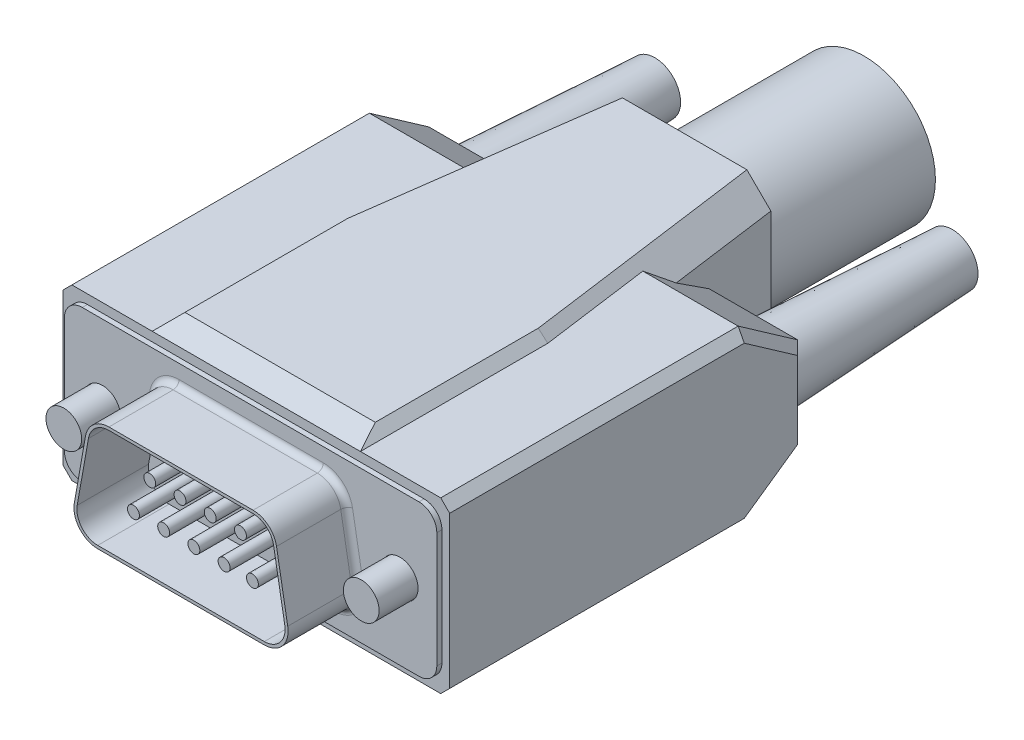
from build123d import *
from OCP.BRepFilletAPI import BRepFilletAPI_MakeChamfer

# Parameters (mm, degrees)
SKETCH1_W                        = 31.3
SKETCH1_H                        = 12.7
SKETCH1_R                        = 1.525
BASE_EXTRUDE_DEPTH               = 0.215
FILLET6_R                        = 1.5
BOSS_EXTRUDE2_DEPTH              = 5.9
FILLET8_R                        = 0.5
CUT_EXTRUDE1_DEPTH               = 6
SKETCH8_R                        = 0.5
BOSS_EXTRUDE3_DEPTH              = 5
LPATTERN1_COUNT                  = 4
LPATTERN1_PITCH                  = 2.54
SKETCH9_W                        = 32.5
SKETCH9_H                        = 14.25
BOSS_EXTRUDE4_DEPTH              = 30
SKETCH11_R                       = 2
CUT_EXTRUDE3_DEPTH               = 20
BOSS_EXTRUDE6_DEPTH              = 6
BOSS_EXTRUDE6_DEPTH_BACK         = 30
SKETCH12_W                       = 17.5
SKETCH12_H                       = 15.75
CHAMFER1_SIZE                    = 5
CHAMFER1_SIZE2                   = 3.5
CHAMFER3_SIZE                    = 11
CHAMFER3_SIZE_2                  = 1.5
CHAMFER4_SIZE                    = 2
CHAMFER6_SIZE                    = 0.75
CHAMFER7_SIZE                    = 0.75
CHAMFER7_SIZE2                   = 2
SKETCH18_R                       = 6
BOSS_EXTRUDE8_DEPTH              = 15.080000066
SKETCH20_R                       = 0.5
BOSS_EXTRUDE10_DEPTH             = 5
SKETCH22_R                       = 2
BOSS_EXTRUDE12_DEPTH             = 2
BOSS_EXTRUDE12_DIRECTION_2_REACH = 42.57
SKETCH21_R                       = 1.5
BOSS_EXTRUDE14_DEPTH             = 3.25
BOSS_EXTRUDE14_DIRECTION_2_REACH = 56.583
SKETCH23_R                       = 3
BOSS_EXTRUDE15_DEPTH             = 16
BOSS_EXTRUDE15_DRAFT             = 3
BOSS_EXTRUDE15_PROFILE_2_DEPTH   = 16
BOSS_EXTRUDE15_PROFILE_2_DRAFT   = 3


# Some blends are built 0.0001 mm under size
with BuildPart() as part:
    # Sketch1 → Base-Extrude (new, symmetric)
    with BuildSketch(Plane.XY):
        with Locations((-0.05, 0)):
            Rectangle(SKETCH1_W, SKETCH1_H)
        with Locations((12.5, 0)):
            Circle(SKETCH1_R, mode=Mode.SUBTRACT)
        with Locations(Location((-12.5, 0, 0), (0, 0, 180))):
            Circle(SKETCH1_R, mode=Mode.SUBTRACT)
    extrude(amount=BASE_EXTRUDE_DEPTH, both=True)

    # Fillet6
    fillet6_edges = [part.edges().sort_by_distance(p)[0] for p in [
        (-15.7, -6.35, 0),
        (15.6, -6.35, 0),
        (15.6, 6.35, 0),
        (-15.7, 6.35, 0),
    ]]
    fillet(fillet6_edges, radius=FILLET6_R)

    # Sketch4 → Boss-Extrude2 (add)
    with BuildSketch(Plane.XY.offset(0.215)):
        with BuildLine():
            Line((7, -4.67), (-7, -4.67))
            ThreePointArc((-7, -4.67), (-8.532088886, -3.955575219), (-8.969615506, -2.322703645))
            Line((-8.969615506, -2.322703645), (-8.028029429, 3.017296355))
            ThreePointArc((-8.028029429, 3.017296355), (-7.343989142, 4.202088886), (-6.058413923, 4.67))
            Line((-6.058413923, 4.67), (6.058413923, 4.67))
            ThreePointArc((6.058413923, 4.67), (7.343989142, 4.202088886), (8.028029429, 3.017296355))
            Line((8.028029429, 3.017296355), (8.969615506, -2.322703645))
            ThreePointArc((8.969615506, -2.322703645), (8.532088886, -3.955575219), (7, -4.67))
        make_face()
    extrude(amount=BOSS_EXTRUDE2_DEPTH)

    # Fillet8
    fillet8_edges = [part.edges().sort_by_distance(p)[0] for p in [
        (-8.532088886, -3.955575219, 0.215),
        (8.498822468, 0.347296355, 0.215),
        (-7.343989142, 4.202088886, 0.215),
        (-8.498822468, 0.347296355, 0.215),
        (0, 4.67, 0.215),
        (7.343989142, 4.202088886, 0.215),
        (8.532088886, -3.955575219, 0.215),
        (0, -4.67, 0.215),
    ]]
    fillet(fillet8_edges, radius=FILLET8_R)

    # Sketch5 → Cut-Extrude1 (cut)
    with BuildSketch(Plane.XY.offset(6.115)):
        with BuildLine():
            Line((-7, -4.42), (7, -4.42))
            ThreePointArc((7, -4.42), (8.340577775, -3.794878317), (8.723413568, -2.366115689))
            Line((8.723413568, -2.366115689), (7.781827491, 2.973884311))
            ThreePointArc((7.781827491, 2.973884311), (7.18329224, 4.010577775), (6.058413923, 4.42))
            Line((6.058413923, 4.42), (-6.058413923, 4.42))
            ThreePointArc((-6.058413923, 4.42), (-7.18329224, 4.010577775), (-7.781827491, 2.973884311))
            Line((-7.781827491, 2.973884311), (-8.723413568, -2.366115689))
            ThreePointArc((-8.723413568, -2.366115689), (-8.340577775, -3.794878317), (-7, -4.42))
        make_face()
    extrude(amount=-CUT_EXTRUDE1_DEPTH, mode=Mode.SUBTRACT)

    # Sketch8 → Boss-Extrude3 (add)
    with BuildSketch(Plane.XY.offset(0.115)):
        with Locations((-5, -1.5)):
            Circle(SKETCH8_R)
        with Locations((-3.625, 1.5)):
            Circle(SKETCH8_R)
    boss_extrude3 = extrude(amount=BOSS_EXTRUDE3_DEPTH)

    # LPattern1: Boss-Extrude3 ×4
    with Locations(*[(i * LPATTERN1_PITCH, 0, 0) for i in range(1, LPATTERN1_COUNT)]):
        add(boss_extrude3)

    # Sketch9 → Boss-Extrude4 (add)
    with BuildSketch(Plane(origin=(0, 0, -0.215), x_dir=(-1, 0, 0), z_dir=(0, 0, -1))):
        Rectangle(SKETCH9_W, SKETCH9_H)
    extrude(amount=BOSS_EXTRUDE4_DEPTH)

    # Sketch11 → Cut-Extrude3 (cut)
    with BuildSketch(Plane(origin=(0, 0, -30.215), x_dir=(-1, 0, 0), z_dir=(0, 0, -1))):
        with Locations((-12.5, 0)):
            Circle(SKETCH11_R)
        with Locations((12.5, 0)):
            Circle(SKETCH11_R)
    extrude(amount=-CUT_EXTRUDE3_DEPTH, mode=Mode.SUBTRACT)

    # Sketch12 → Boss-Extrude6 (add, two sides: drawn at the far end of the back side and taken through both)
    with BuildSketch(Plane(origin=(0, 0, -30.215), x_dir=(-1, 0, 0), z_dir=(0, 0, -1)).offset(-BOSS_EXTRUDE6_DEPTH_BACK)):
        Rectangle(SKETCH12_W, SKETCH12_H)
    extrude(amount=BOSS_EXTRUDE6_DEPTH + BOSS_EXTRUDE6_DEPTH_BACK)

    # Chamfer1: one chamfer whose edges measure the first distance from different faces: ONE call of the kernel's chamfer builder (chamfer() names one face for all edges)
    chamfer1_edges_1 = [part.edges().sort_by_distance(p)[0] for p in [
        (12.5, -7.125, -30.215),
    ]]
    chamfer1_side_1 = [part.faces().sort_by_distance(p)[0] for p in [
        (12.5, -7.125, -15.215),
    ]]
    chamfer1_edges_2 = [part.edges().sort_by_distance(p)[0] for p in [
        (-12.5, 7.125, -30.215),
    ]]
    chamfer1_side_2 = [part.faces().sort_by_distance(p)[0] for p in [
        (-12.5, 7.125, -15.215),
    ]]
    chamfer1_edges_3 = [part.edges().sort_by_distance(p)[0] for p in [
        (-12.5, -7.125, -30.215),
    ]]
    chamfer1_side_3 = [part.faces().sort_by_distance(p)[0] for p in [
        (-12.5, -7.125, -15.215),
    ]]
    chamfer1_edges_4 = [part.edges().sort_by_distance(p)[0] for p in [
        (12.5, 7.125, -30.215),
    ]]
    chamfer1_side_4 = [part.faces().sort_by_distance(p)[0] for p in [
        (12.5, 7.125, -15.215),
    ]]
    chamfer1 = BRepFilletAPI_MakeChamfer(part.part.solid().wrapped)
    for e in chamfer1_edges_1:
        chamfer1.Add(CHAMFER1_SIZE, CHAMFER1_SIZE2, e.wrapped, chamfer1_side_1[0].wrapped)  # the first distance lies on this face
    for e in chamfer1_edges_2:
        chamfer1.Add(CHAMFER1_SIZE, CHAMFER1_SIZE2, e.wrapped, chamfer1_side_2[0].wrapped)  # the first distance lies on this face
    for e in chamfer1_edges_3:
        chamfer1.Add(CHAMFER1_SIZE, CHAMFER1_SIZE2, e.wrapped, chamfer1_side_3[0].wrapped)  # the first distance lies on this face
    for e in chamfer1_edges_4:
        chamfer1.Add(CHAMFER1_SIZE, CHAMFER1_SIZE2, e.wrapped, chamfer1_side_4[0].wrapped)  # the first distance lies on this face
    add(Compound.cast(chamfer1.Shape()), mode=Mode.REPLACE)

    # Chamfer3
    # the kernel refuses this chamfer: 11, 1.5 mm, written as the material it takes off along each edge
    with BuildSketch(Plane(origin=(8.75, -36.465299494, -36.215), x_dir=(0, 0, 1), z_dir=(0, 1, 0))) as chamfer3_piece_1_section:
        Polygon((CHAMFER3_SIZE, 0), (0, -CHAMFER3_SIZE_2), (0, 0), align=None)
    chamfer3_piece_1 = extrude(amount=72.930598988, mode=Mode.PRIVATE)
    chamfer3_piece_1 = split(chamfer3_piece_1, bisect_by=Plane(origin=(8.75, -11.606038089, -18.813517016), z_dir=(0, -0.8192319205190406, -0.5734623443633283)), keep=Keep.TOP, mode=Mode.PRIVATE)
    add(chamfer3_piece_1, mode=Mode.SUBTRACT)
    with BuildSketch(Plane(origin=(8.75, -36.465299494, -36.215), x_dir=(0, 0, 1), z_dir=(0, 1, 0))) as chamfer3_piece_2_section:
        Polygon((CHAMFER3_SIZE, 0), (0, -CHAMFER3_SIZE_2), (0, 0), align=None)
    chamfer3_piece_2 = extrude(amount=72.930598988, mode=Mode.PRIVATE)
    chamfer3_piece_2 = split(chamfer3_piece_2, bisect_by=Plane(origin=(8.75, -36.465299494, -30.215), z_dir=(0, 0, -1)), keep=Keep.TOP, mode=Mode.PRIVATE)
    add(chamfer3_piece_2, mode=Mode.SUBTRACT)
    with BuildSketch(Plane(origin=(8.75, -36.465299494, -36.215), x_dir=(0, 0, 1), z_dir=(0, 1, 0))) as chamfer3_piece_3_section:
        Polygon((CHAMFER3_SIZE, 0), (0, -CHAMFER3_SIZE_2), (0, 0), align=None)
    chamfer3_piece_3 = extrude(amount=72.930598988, mode=Mode.PRIVATE)
    chamfer3_piece_3 = split(chamfer3_piece_3, bisect_by=Plane(origin=(8.75, -12.377850169, -53.076214527), z_dir=(0, 0.8192319205190406, -0.5734623443633283)), keep=Keep.TOP, mode=Mode.PRIVATE)
    add(chamfer3_piece_3, mode=Mode.SUBTRACT)
    with BuildSketch(Plane(origin=(-8.75, 36.465299494, -36.215), x_dir=(1, 0, 0), z_dir=(0, -1, 0))) as chamfer3_piece_4_section:
        Polygon((CHAMFER3_SIZE_2, 0), (0, CHAMFER3_SIZE), (0, 0), align=None)
    chamfer3_piece_4 = extrude(amount=72.930598988, mode=Mode.PRIVATE)
    chamfer3_piece_4 = split(chamfer3_piece_4, bisect_by=Plane(origin=(-8.75, 36.465299494, -30.215), z_dir=(0, 0, -1)), keep=Keep.TOP, mode=Mode.PRIVATE)
    add(chamfer3_piece_4, mode=Mode.SUBTRACT)
    with BuildSketch(Plane(origin=(-8.75, 36.465299494, -36.215), x_dir=(1, 0, 0), z_dir=(0, -1, 0))) as chamfer3_piece_5_section:
        Polygon((CHAMFER3_SIZE_2, 0), (0, CHAMFER3_SIZE), (0, 0), align=None)
    chamfer3_piece_5 = extrude(amount=72.930598988, mode=Mode.PRIVATE)
    chamfer3_piece_5 = split(chamfer3_piece_5, bisect_by=Plane(origin=(-8.75, 11.606038089, -18.813517016), z_dir=(0, 0.8192319205190406, -0.5734623443633283)), keep=Keep.TOP, mode=Mode.PRIVATE)
    add(chamfer3_piece_5, mode=Mode.SUBTRACT)
    with BuildSketch(Plane(origin=(-8.75, 36.465299494, -36.215), x_dir=(1, 0, 0), z_dir=(0, -1, 0))) as chamfer3_piece_6_section:
        Polygon((CHAMFER3_SIZE_2, 0), (0, CHAMFER3_SIZE), (0, 0), align=None)
    chamfer3_piece_6 = extrude(amount=72.930598988, mode=Mode.PRIVATE)
    chamfer3_piece_6 = split(chamfer3_piece_6, bisect_by=Plane(origin=(-8.75, 12.377850169, -53.076214527), z_dir=(0, -0.8192319205190406, -0.5734623443633283)), keep=Keep.TOP, mode=Mode.PRIVATE)
    add(chamfer3_piece_6, mode=Mode.SUBTRACT)

    # Chamfer4
    # the kernel refuses this chamfer: 2 mm, written as the material it takes off along each edge
    with BuildSketch(Plane(origin=(10.83480998, 7.875, -9.926393477), x_dir=(0, -1, 0), z_dir=(-0.1351132047333135, 0, -0.990830168044299))) as chamfer4_piece_1_section:
        Polygon((CHAMFER4_SIZE, 0), (0, CHAMFER4_SIZE), (0, 0), align=None)
    chamfer4_piece_1 = extrude(amount=31.675265559, mode=Mode.PRIVATE)
    chamfer4_piece_1 = split(chamfer4_piece_1, bisect_by=Plane(origin=(10.83480998, 7.125, -9.926393477), z_dir=(0, 1, 0)), keep=Keep.TOP, mode=Mode.PRIVATE)
    add(chamfer4_piece_1, mode=Mode.SUBTRACT)
    with BuildSketch(Plane(origin=(10.83480998, 7.875, -9.926393477), x_dir=(0, -1, 0), z_dir=(-0.1351132047333135, 0, -0.990830168044299))) as chamfer4_piece_2_section:
        Polygon((CHAMFER4_SIZE, 0), (0, CHAMFER4_SIZE), (0, 0), align=None)
    chamfer4_piece_2 = extrude(amount=31.675265559, mode=Mode.PRIVATE)
    chamfer4_piece_2 = split(chamfer4_piece_2, bisect_by=Plane(origin=(10.83480998, 14.554211118, -14.60184126), z_dir=(0, 0.8192319205190406, -0.5734623443633283)), keep=Keep.TOP, mode=Mode.PRIVATE)
    add(chamfer4_piece_2, mode=Mode.SUBTRACT)
    with BuildSketch(Plane(origin=(-6.55506334, 7.875, -41.311202174), x_dir=(0, -1, 0), z_dir=(-0.13511320473331356, 0, 0.9908301680442989))) as chamfer4_piece_3_section:
        Polygon((CHAMFER4_SIZE, 0), (0, CHAMFER4_SIZE), (0, 0), align=None)
    chamfer4_piece_3 = extrude(amount=31.675265559, mode=Mode.PRIVATE)
    chamfer4_piece_3 = split(chamfer4_piece_3, bisect_by=Plane(origin=(-6.55506334, -0.190329881, -35.665471258), z_dir=(0, 0.8192319205190406, -0.5734623443633283)), keep=Keep.TOP, mode=Mode.PRIVATE)
    add(chamfer4_piece_3, mode=Mode.SUBTRACT)
    with BuildSketch(Plane(origin=(-6.55506334, 7.875, -41.311202174), x_dir=(0, -1, 0), z_dir=(-0.13511320473331356, 0, 0.9908301680442989))) as chamfer4_piece_4_section:
        Polygon((CHAMFER4_SIZE, 0), (0, CHAMFER4_SIZE), (0, 0), align=None)
    chamfer4_piece_4 = extrude(amount=31.675265559, mode=Mode.PRIVATE)
    chamfer4_piece_4 = split(chamfer4_piece_4, bisect_by=Plane(origin=(-6.55506334, 7.125, -41.311202174), z_dir=(0, 1, 0)), keep=Keep.TOP, mode=Mode.PRIVATE)
    add(chamfer4_piece_4, mode=Mode.SUBTRACT)
    with BuildSketch(Plane(origin=(6.55506334, -7.875, -41.311202174), x_dir=(0, 1, 0), z_dir=(0.13511320473331356, 0, 0.9908301680442989))) as chamfer4_piece_5_section:
        Polygon((CHAMFER4_SIZE, 0), (0, CHAMFER4_SIZE), (0, 0), align=None)
    chamfer4_piece_5 = extrude(amount=31.675265559, mode=Mode.PRIVATE)
    chamfer4_piece_5 = split(chamfer4_piece_5, bisect_by=Plane(origin=(6.55506334, 0.190329881, -35.665471258), z_dir=(0, -0.8192319205191814, -0.573462344363127)), keep=Keep.TOP, mode=Mode.PRIVATE)
    add(chamfer4_piece_5, mode=Mode.SUBTRACT)
    with BuildSketch(Plane(origin=(6.55506334, -7.875, -41.311202174), x_dir=(0, 1, 0), z_dir=(0.13511320473331356, 0, 0.9908301680442989))) as chamfer4_piece_6_section:
        Polygon((CHAMFER4_SIZE, 0), (0, CHAMFER4_SIZE), (0, 0), align=None)
    chamfer4_piece_6 = extrude(amount=31.675265559, mode=Mode.PRIVATE)
    chamfer4_piece_6 = split(chamfer4_piece_6, bisect_by=Plane(origin=(6.55506334, -7.125, -41.311202174), z_dir=(0, -1, 0)), keep=Keep.TOP, mode=Mode.PRIVATE)
    add(chamfer4_piece_6, mode=Mode.SUBTRACT)
    with BuildSketch(Plane(origin=(-10.83480998, -7.875, -9.926393477), x_dir=(0.990830168044299, 0, 0.1351132047333135), z_dir=(0.1351132047333135, 0, -0.990830168044299))) as chamfer4_piece_7_section:
        Polygon((CHAMFER4_SIZE, 0), (0, -CHAMFER4_SIZE), (0, 0), align=None)
    chamfer4_piece_7 = extrude(amount=31.675265559, mode=Mode.PRIVATE)
    chamfer4_piece_7 = split(chamfer4_piece_7, bisect_by=Plane(origin=(-10.83480998, -7.125, -9.926393477), z_dir=(0, -1, 0)), keep=Keep.TOP, mode=Mode.PRIVATE)
    add(chamfer4_piece_7, mode=Mode.SUBTRACT)
    with BuildSketch(Plane(origin=(-10.83480998, -7.875, -9.926393477), x_dir=(0.990830168044299, 0, 0.1351132047333135), z_dir=(0.1351132047333135, 0, -0.990830168044299))) as chamfer4_piece_8_section:
        Polygon((CHAMFER4_SIZE, 0), (0, -CHAMFER4_SIZE), (0, 0), align=None)
    chamfer4_piece_8 = extrude(amount=31.675265559, mode=Mode.PRIVATE)
    chamfer4_piece_8 = split(chamfer4_piece_8, bisect_by=Plane(origin=(-10.83480998, -14.554211118, -14.60184126), z_dir=(0, -0.8192319205190406, -0.5734623443633283)), keep=Keep.TOP, mode=Mode.PRIVATE)
    add(chamfer4_piece_8, mode=Mode.SUBTRACT)

    # Chamfer6
    chamfer6_edges = [part.edges().sort_by_distance(p)[0] for p in [
        (-16.25, 0, -30.215),
        (-16.25, 7.125, -12.715),
        (-16.25, -7.125, -12.715),
        (-16.25, -5.375, -27.715),
        (-16.25, 5.375, -27.715),
        (16.25, 0, -30.215),
        (16.25, -7.125, -12.715),
        (16.25, 7.125, -12.715),
        (16.25, -5.375, -27.715),
        (16.25, 5.375, -27.715),
        (-8.75, 7.875, -5.313798896),
        (8.75, 7.875, -5.313798896),
        (-8.75, -7.875, -5.313798896),
        (8.75, -7.875, -5.313798896),
    ]]
    chamfer(chamfer6_edges, length=CHAMFER6_SIZE - 0.0001)  # a hair under: the kernel refuses the full size

    # Chamfer7
    chamfer7_edges = [part.edges().sort_by_distance(p)[0] for p in [
        (0, 7.875, -0.215),
        (0, -7.875, -0.215),
    ]]
    chamfer7_side = [part.faces().sort_by_distance(p)[0] for p in [
        (15.888847331, 0, -0.215),
    ]]
    chamfer(chamfer7_edges, length=CHAMFER7_SIZE, length2=CHAMFER7_SIZE2, reference=chamfer7_side[0])

    # Sketch18 → Boss-Extrude8 (add)
    with BuildSketch(Plane(origin=(0, 0, -36.215), x_dir=(-1, 0, 0), z_dir=(0, 0, -1))):
        with Locations(Location((0, 0, 0), (0, 0, 180))):
            Circle(SKETCH18_R)
    extrude(amount=BOSS_EXTRUDE8_DEPTH)

    # Sketch20 → Boss-Extrude10 (add)
    with BuildSketch(Plane.XY.offset(0.115)):
        with Locations((5, -1.5)):
            Circle(SKETCH20_R)
    extrude(amount=BOSS_EXTRUDE10_DEPTH)

    # Sketch22 → Boss-Extrude12 (add)
    with BuildSketch(Plane(origin=(0, 0, -30.215), x_dir=(-1, 0, 0), z_dir=(0, 0, -1))):
        with Locations((12.5, 0)):
            Circle(SKETCH22_R)
        with Locations((-12.5, 0)):
            Circle(SKETCH22_R)
    extrude(amount=BOSS_EXTRUDE12_DEPTH)

    # Sketch22 → Boss-Extrude12 direction 2 (add, up to next)
    with BuildSketch(Plane(origin=(0, 0, -30.215), x_dir=(-1, 0, 0), z_dir=(0, 0, -1)), mode=Mode.PRIVATE) as boss_extrude12_direction_2_sk1:
        with Locations((12.5, 0)):
            Circle(SKETCH22_R)
    boss_extrude12_direction_2_tool1 = extrude(boss_extrude12_direction_2_sk1.sketch, amount=-BOSS_EXTRUDE12_DIRECTION_2_REACH, mode=Mode.PRIVATE) - part.part
    # Sketch22 → Boss-Extrude12 direction 2 (add, up to next)
    with BuildSketch(Plane(origin=(0, 0, -30.215), x_dir=(-1, 0, 0), z_dir=(0, 0, -1)), mode=Mode.PRIVATE) as boss_extrude12_direction_2_sk2:
        with Locations((-12.5, 0)):
            Circle(SKETCH22_R)
    boss_extrude12_direction_2_tool2 = extrude(boss_extrude12_direction_2_sk2.sketch, amount=-BOSS_EXTRUDE12_DIRECTION_2_REACH, mode=Mode.PRIVATE) - part.part
    add(boss_extrude12_direction_2_tool1.solids().sort_by_distance((-12.5, 0, -30.215))[0])
    add(boss_extrude12_direction_2_tool2.solids().sort_by_distance((12.5, 0, -30.215))[0])

    # Sketch21 → Boss-Extrude14 (add)
    with BuildSketch(Plane.XY.offset(0.215)):
        with Locations((-12.5, 0)):
            Circle(SKETCH21_R)
        with Locations((12.5, 0)):
            Circle(SKETCH21_R)
    extrude(amount=BOSS_EXTRUDE14_DEPTH)

    # Sketch21 → Boss-Extrude14 direction 2 (add, up to next)
    with BuildSketch(Plane.XY.offset(0.215), mode=Mode.PRIVATE) as boss_extrude14_direction_2_sk1:
        with Locations((-12.5, 0)):
            Circle(SKETCH21_R)
    boss_extrude14_direction_2_tool1 = extrude(boss_extrude14_direction_2_sk1.sketch, amount=-BOSS_EXTRUDE14_DIRECTION_2_REACH, mode=Mode.PRIVATE) - part.part
    # Sketch21 → Boss-Extrude14 direction 2 (add, up to next)
    with BuildSketch(Plane.XY.offset(0.215), mode=Mode.PRIVATE) as boss_extrude14_direction_2_sk2:
        with Locations((12.5, 0)):
            Circle(SKETCH21_R)
    boss_extrude14_direction_2_tool2 = extrude(boss_extrude14_direction_2_sk2.sketch, amount=-BOSS_EXTRUDE14_DIRECTION_2_REACH, mode=Mode.PRIVATE) - part.part
    add(boss_extrude14_direction_2_tool1.solids().sort_by_distance((-12.5, 0, 0.215))[0])
    add(boss_extrude14_direction_2_tool2.solids().sort_by_distance((12.5, 0, 0.215))[0])


with BuildPart() as boss_extrude15_tool:
    # Sketch23 → Boss-Extrude15 (with draft: the straight prism first)
    with BuildSketch(Plane(origin=(0, 0, -30.215), x_dir=(-1, 0, 0), z_dir=(0, 0, -1))):
        with Locations((12.5, 0)):
            Circle(SKETCH23_R)
    extrude(amount=BOSS_EXTRUDE15_DEPTH)
    # Boss-Extrude15: the draft: its side faces are tilted about the plane it starts from
    boss_extrude15_sides = [boss_extrude15_tool.faces().sort_by_distance(p)[0] for p in [
        (-9.5, 0, -38.215),
    ]]
    draft(boss_extrude15_sides, Plane(origin=(0, 0, -30.215), x_dir=(-1, 0, 0), z_dir=(0, 0, -1)), BOSS_EXTRUDE15_DRAFT)


with BuildPart() as part_1:
    add(part.part)

    # Boss-Extrude15: add boss_extrude15_tool
    add(boss_extrude15_tool.part)


with BuildPart() as boss_extrude15_profile_2_tool:
    # Sketch23 → Boss-Extrude15 profile 2 (with draft: the straight prism first)
    with BuildSketch(Plane(origin=(0, 0, -30.215), x_dir=(-1, 0, 0), z_dir=(0, 0, -1))):
        with Locations((-12.5, 0)):
            Circle(SKETCH23_R)
    extrude(amount=BOSS_EXTRUDE15_PROFILE_2_DEPTH)
    # Boss-Extrude15 profile 2: the draft: its side faces are tilted about the plane it starts from
    boss_extrude15_profile_2_sides = [boss_extrude15_profile_2_tool.faces().sort_by_distance(p)[0] for p in [
        (15.5, 0, -38.215),
    ]]
    draft(boss_extrude15_profile_2_sides, Plane(origin=(0, 0, -30.215), x_dir=(-1, 0, 0), z_dir=(0, 0, -1)), BOSS_EXTRUDE15_PROFILE_2_DRAFT)


with BuildPart() as part_2:
    add(part_1.part)

    # Boss-Extrude15 profile 2: add boss_extrude15_profile_2_tool
    add(boss_extrude15_profile_2_tool.part)


solid = part_2.part
